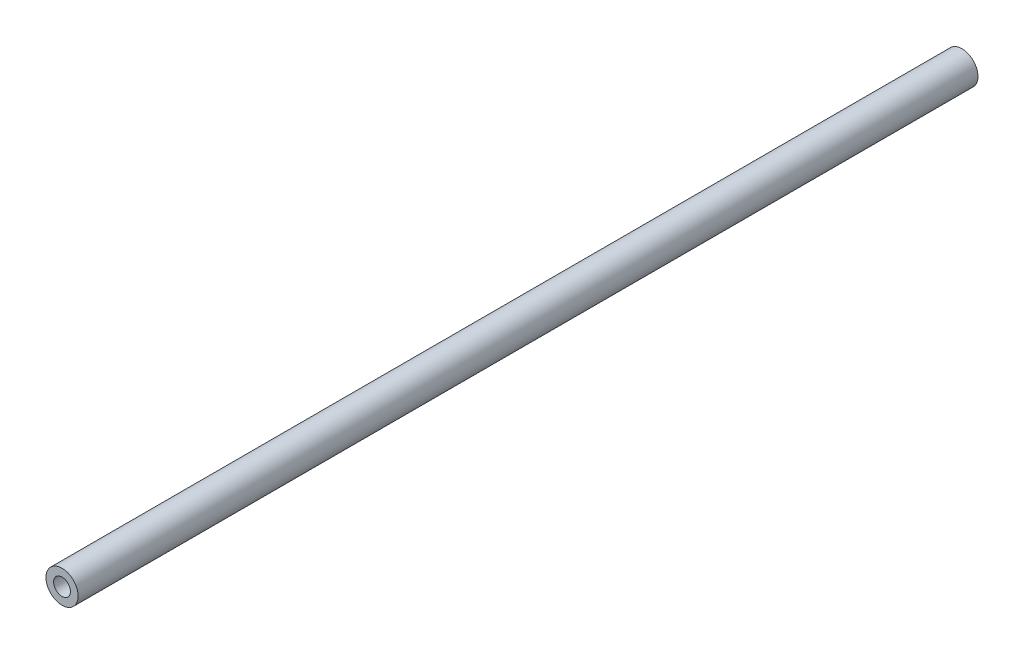
from build123d import *

# Parameters (mm, degrees)
SKETCH1_R           = 4.7625
SKETCH1_R_2         = 2.4892
BOSS_EXTRUDE1_DEPTH = 133.35


with BuildPart() as part:
    # Sketch1 → Boss-Extrude1 (new, symmetric)
    with BuildSketch(Plane.XY):
        Circle(SKETCH1_R)
        Circle(SKETCH1_R_2, mode=Mode.SUBTRACT)
    extrude(amount=BOSS_EXTRUDE1_DEPTH, both=True)


solid = part.part
